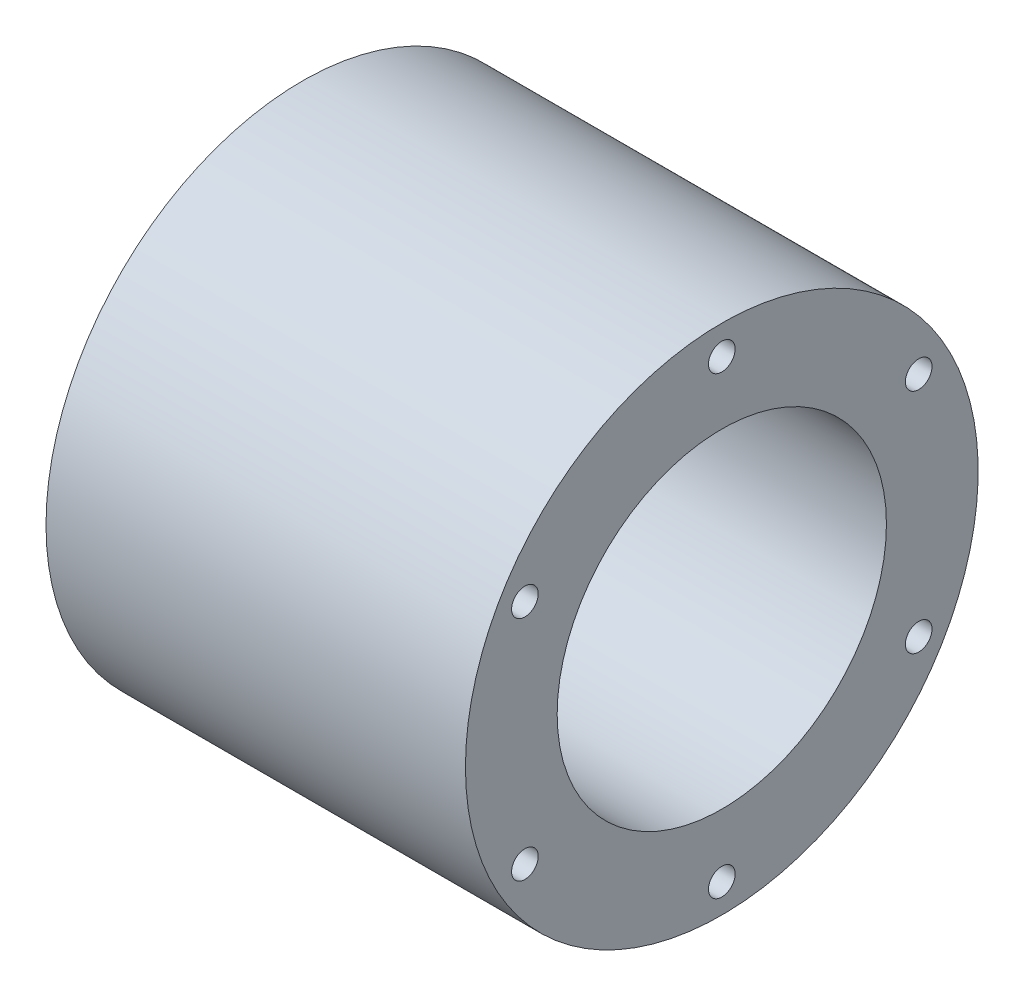
from build123d import *

# Parameters (mm, degrees)
CROQUIS1_R                       = 32.7
CROQUIS1_R_2                     = 21
SALIENTE_EXTRUIR1_DEPTH          = 24.25
CROQUIS3_R                       = 32.7
SALIENTE_EXTRUIR3_DEPTH          = 5
CROQUIS4_R                       = 3.5
CORTAR_EXTRUIR1_DEPTH            = 6
TALADRO_DE_MARGEN_PARA_M31_D     = 3.4
TALADRO_DE_MARGEN_PARA_M31_DEPTH = 10
TALADRO_DE_MARGEN_PARA_M31_TIP   = 1.021463052


with BuildPart() as part:
    # Croquis1 → Saliente-Extruir1 (new, symmetric)
    with BuildSketch(Plane(origin=(0, 0, 0), x_dir=(0, 0, -1), z_dir=(1, 0, 0))):
        Circle(CROQUIS1_R)
        Circle(CROQUIS1_R_2, mode=Mode.SUBTRACT)
    extrude(amount=SALIENTE_EXTRUIR1_DEPTH, both=True)

    # Croquis3 → Saliente-Extruir3 (add)
    with BuildSketch(Plane.ZY.offset(24.25)):
        Circle(CROQUIS3_R)
        with BuildLine():
            Line((-18, -21), (18, -21))
            ThreePointArc((18, -21), (20.121320344, -20.121320344), (21, -18))
            Line((21, -18), (21, 18))
            ThreePointArc((21, 18), (20.121320344, 20.121320344), (18, 21))
            Line((18, 21), (-18, 21))
            ThreePointArc((-18, 21), (-20.121320344, 20.121320344), (-21, 18))
            Line((-21, 18), (-21, -18))
            ThreePointArc((-21, -18), (-20.121320344, -20.121320344), (-18, -21))
        make_face(mode=Mode.SUBTRACT)
    extrude(amount=SALIENTE_EXTRUIR3_DEPTH)

    # Croquis4 → Cortar-Extruir1 (cut)
    with BuildSketch(Plane.ZY.offset(24.25)):
        with Locations((15.5, 15.5)):
            Circle(CROQUIS4_R)
        with Locations((-15.5, 15.5)):
            Circle(CROQUIS4_R)
        with Locations((-15.5, -15.5)):
            Circle(CROQUIS4_R)
        with Locations((15.5, -15.5)):
            Circle(CROQUIS4_R)
    extrude(amount=-CORTAR_EXTRUIR1_DEPTH, mode=Mode.SUBTRACT)

    # Taladro de margen para M31
    with Locations(Plane(origin=(24.25, 0, 0), x_dir=(0, 0, -1), z_dir=(1, 0, 0))):
        with Locations((0, 29), (25.11473671, 14.5), (25.11473671, -14.5), (0, -29), (-25.11473671, -14.5), (-25.11473671, 14.5)):
            Hole(TALADRO_DE_MARGEN_PARA_M31_D / 2, depth=TALADRO_DE_MARGEN_PARA_M31_DEPTH)
            with Locations((0, 0, -(TALADRO_DE_MARGEN_PARA_M31_DEPTH + TALADRO_DE_MARGEN_PARA_M31_TIP / 2))):  # 118° drill point
                Cone(0, TALADRO_DE_MARGEN_PARA_M31_D / 2, TALADRO_DE_MARGEN_PARA_M31_TIP, mode=Mode.SUBTRACT)


solid = part.part
